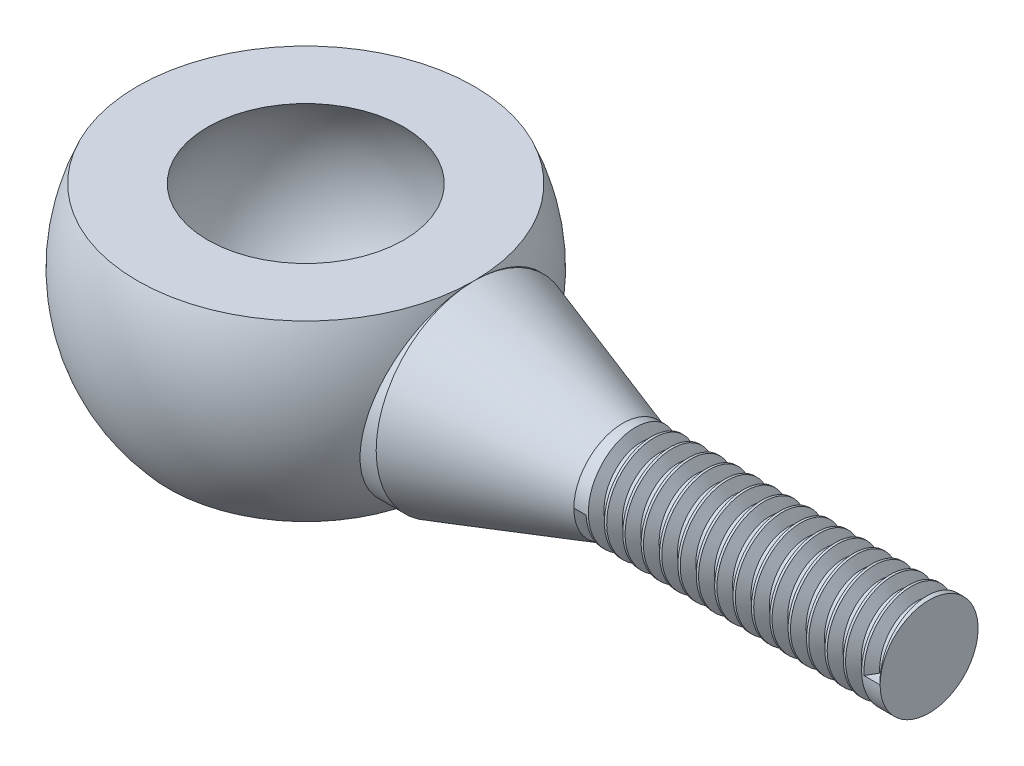
from build123d import *

# Parameters (mm, degrees)
BOSS_EXTRUDE1_REACH = 35.933
SKETCH4_R           = 8
SKETCH5_R           = 4
BOSS_EXTRUDE2_DEPTH = 25
THREAD1_PITCH       = 1.5


with BuildPart() as part:
    # Sketch1 → Revolve1 (revolve)
    with BuildSketch(Plane.XY):
        with BuildLine():
            Line((4, -10), (11.180339887, -10))
            ThreePointArc((11.180339887, -10), (14.810541204, -2.376524617), (13.747727085, 6))
            Line((13.747727085, 6), (8, 6))
            ThreePointArc((8, 6), (9.669304741, -2.550401112), (4, -9.16515139))
            Line((4, -9.16515139), (4, -10))
        make_face()
    revolve(axis=Axis((0, 6.906008975, 0), (0, -1, 0)))

    # Sketch2 → Revolve2 (revolve)
    with BuildSketch(Plane.XY, mode=Mode.PRIVATE) as revolve2_sk:
        Polygon((13.747727085, 6), (25.884634623, 2), (25.884634623, -2), (13.747727085, -2), align=None)
    revolve(revolve2_sk.sketch.rotate(Axis((6.541533528, -2, 0), (1, 0, 0)), 90), axis=Axis((6.541533528, -2, 0), (1, 0, 0)))

    # Sketch4 → Boss-Extrude1 (add, up to next)
    with BuildSketch(Plane.ZY.offset(-13.747727085), mode=Mode.PRIVATE) as boss_extrude1_sk1:
        with Locations((0, -2)):
            Circle(SKETCH4_R)
    boss_extrude1_tool1 = extrude(boss_extrude1_sk1.sketch, amount=BOSS_EXTRUDE1_REACH, mode=Mode.PRIVATE) - part.part
    add(boss_extrude1_tool1.solids().sort_by_distance((13.747727, -2, 0))[0])

    # Sketch5 → Boss-Extrude2 (add)
    with BuildSketch(Plane(origin=(25.884634623, 0, 0), x_dir=(0, 0, -1), z_dir=(1, 0, 0))):
        with Locations((0, -2)):
            Circle(SKETCH5_R)
    extrude(amount=BOSS_EXTRUDE2_DEPTH)

    # Thread1: the profile of Thread Profile1 profile screwed along a right-hand helix of 16 turns, 8 arcs to a turn; built about Z, then put on its axis
    thread1_z = Axis((0, 0, 0), (0, 0, 1))
    thread1_corners = [(4.0003, 0, -0.000173205), (4.0003, 0, 1.312673201), (3.188101188, 0, 0.843749998), (3.188101188, 0, 0.468749998)]
    with BuildLine(mode=Mode.PRIVATE) as thread1_profile:
        Line(thread1_corners[0], thread1_corners[1])
        Line(thread1_corners[1], thread1_corners[2])
        Line(thread1_corners[2], thread1_corners[3])
        Line(thread1_corners[3], thread1_corners[0])
    thread1_cap = Face(thread1_profile.wire())
    thread1_turn_angles = [0, 22.5, 45, 67.5, 90, 112.5, 135, 157.5, 180, 202.5, 225, 247.5, 270, 292.5, 315, 337.5, 360]
    thread1_turn_weights = [1, 0.9238795325112867, 1, 0.9238795325112867, 1, 0.9238795325112867, 1, 0.9238795325112867, 1, 0.9238795325112867, 1, 0.9238795325112867, 1, 0.9238795325112867, 1, 0.9238795325112867, 1]
    thread1_turn_rails = [Edge.make_bspline([Vector(p[0], p[1], 0).rotate(thread1_z, thread1_turn_angles[k]) / thread1_turn_weights[k] + Vector(0, 0, p[2] + THREAD1_PITCH * thread1_turn_angles[k] / 360) for k in range(17)], [0, 0, 0, 1, 1, 2, 2, 3, 3, 4, 4, 5, 5, 6, 6, 7, 7, 8, 8, 8], 2, thread1_turn_weights) for p in thread1_corners]
    thread1_turn_sides = [Face.make_surface_from_curves(thread1_turn_rails[p[0]], thread1_turn_rails[p[1]]) for p in [(0, 1), (1, 2), (2, 3), (3, 0)]]
    thread1 = Plane(origin=(50.884634623, -2, 0), x_dir=(0, 0, 1), z_dir=(-1, 0, 0)) * Solid(Shell([*[p.moved(Location((0, 0, THREAD1_PITCH * i))) for i in range(16) for p in thread1_turn_sides], thread1_cap, thread1_cap.rotate(thread1_z, 5760).moved(Location((0, 0, THREAD1_PITCH * 5760 / 360)))]))
    add(thread1, mode=Mode.SUBTRACT)


solid = part.part
